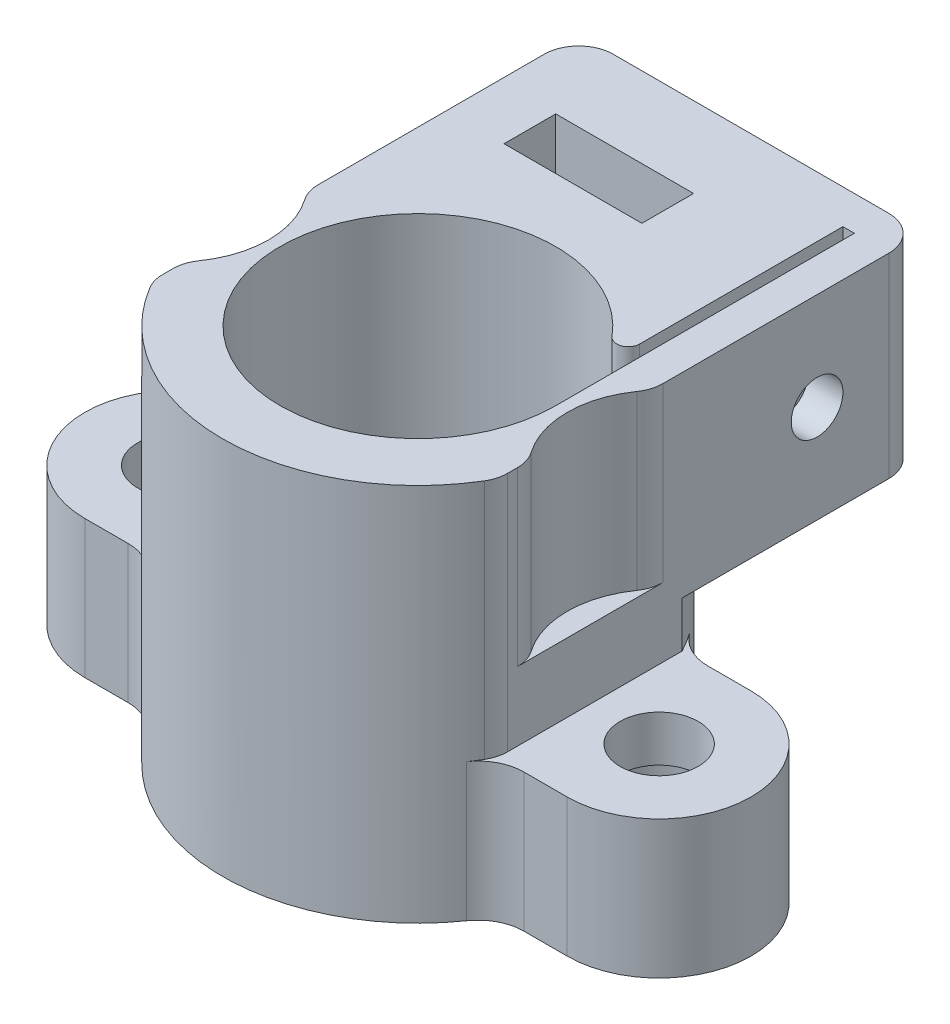
from build123d import *
from build123d.topology import SkipClean

# Parameters (mm, degrees)
BOSS_EXTRU_1_START      = -6
BOSS_EXTRU_1_DEPTH      = 6
BOSS_EXTRU_2_START      = -6
BOSS_EXTRU_2_DEPTH      = 2
ENL_V_START             = -4
ENL_V_MAT_EXTRU_1_DEPTH = 4
ENL_V_START_2           = -16.5
ENL_V_MAT_EXTRU_5_DEPTH = 10.5
CONG_1_R                = 2
CHANFREIN1_SIZE         = 0.5
SYM_TRIE1_START         = -2
SYM_TRIE1_DEPTH         = 10.5
SYM_TRIE1_START_2       = -8
SYM_TRIE1_2_DEPTH       = 4
SYM_TRIE1_START_3       = -7.5000001
SYM_TRIE1_3_DEPTH       = 5.5000001
SYM_TRIE1_START_4       = -4
SYM_TRIE1_4_DEPTH       = 2
SYM_TRIE1_7_DEPTH       = 0.4999999
M3_CLEARANCE_HOLE1_D    = 3.4
BOSS_EXTRU_3_DEPTH      = 8.5
ENL_V_START_3           = -8.5
ENL_V_MAT_EXTRU_2_DEPTH = 8.5
ENL_V_START_4           = -6.5
ESQUISSE5_R             = 1.125
ENL_V_MAT_EXTRU_3_DEPTH = 6
ESQUISSE5_3_R           = 1.125
ENL_V_MAT_EXTRU_4_DEPTH = 6.5
CONG_2_R                = 0.5
CONG_3_R                = 1.5
ENL_V_START_5           = -7.5
ESQUISSE9_R             = 4
ENL_V_MAT_EXTRU_8_DEPTH = 7.5
CONG_5_R                = 1.5
CHANFREIN2_SIZE         = 1


with BuildPart() as part:
    # Esquisse1 → Révolution1 (revolve)
    with BuildSketch(Plane.XY):
        Polygon((-8.5, 8.5), (-6, 8.5), (-6, 0), (-3.5, 0), (-3.5, -1), (-4.383974596, -1), (-5.25, -1.5), (-6.5, -1.5), (-6.5, -8), (-8.5, -8), align=None)
    revolve(axis=Axis((0, 6.43509573, 0), (0, -1, 0)))

    # Esquisse3 → Boss.-Extru.1 (add)
    with BuildSketch(Plane.XZ.offset(8).offset(BOSS_EXTRU_1_START)):
        with BuildLine():
            ThreePointArc((-7.928571429, 3.06394437), (-7.728470361, 3.5384666), (-7.5, 4))
            Line((-7.5, 4), (-10.5, 4))
            ThreePointArc((-10.5, 4), (-14.5, 0), (-10.5, -4))
            Line((-10.5, -4), (-7.5, -4))
            ThreePointArc((-7.5, -4), (-7.728470361, -3.5384666), (-7.928571429, -3.06394437))
            ThreePointArc((-7.928571429, -3.06394437), (-8.196108254, -2.252511816), (-8.380833333, -1.418320358))
            ThreePointArc((-8.380833333, -1.418320358), (-13.05, 0), (-8.380833333, 1.418320358))
            ThreePointArc((-8.380833333, 1.418320358), (-8.196108254, 2.252511816), (-7.928571429, 3.06394437))
        make_face()
    extrude(amount=BOSS_EXTRU_1_DEPTH)

    # Esquisse3<4> → Boss.-Extru.2 (add)
    with BuildSketch(Plane.XZ.offset(8).offset(BOSS_EXTRU_2_START)):
        with BuildLine():
            ThreePointArc((-8.380833333, -1.418320358), (-8.5, 0), (-8.380833333, 1.418320358))
            ThreePointArc((-8.380833333, 1.418320358), (-13.05, 0), (-8.380833333, -1.418320358))
        make_face()
    extrude(amount=BOSS_EXTRU_2_DEPTH)

    # Esquisse3<5> → Enlèv. mat.-Extru.1 (cut)
    with SkipClean():  # the faces are left unmerged after this step: merging them gives an invalid solid
        with BuildSketch(Plane.XZ.offset(8).offset(ENL_V_START)):
            with BuildLine():
                ThreePointArc((-7.95, 0), (-8.06008453, 0.741156191), (-8.380833333, 1.418320358))
                ThreePointArc((-8.380833333, 1.418320358), (-8.5, 0), (-8.380833333, -1.418320358))
                ThreePointArc((-8.380833333, -1.418320358), (-8.06008453, -0.741156191), (-7.95, 0))
            make_face()
        extrude(amount=ENL_V_MAT_EXTRU_1_DEPTH, mode=Mode.SUBTRACT)

    # Esquisse3<7> → Enlèv. mat.-Extru.5 (cut)
    with SkipClean():  # the faces are left unmerged after this step: merging them gives an invalid solid
        with BuildSketch(Plane.XZ.offset(8).offset(ENL_V_START_2)):
            with BuildLine():
                ThreePointArc((-7.5, 4), (-8.5, 0), (-7.5, -4))
                Line((-7.5, -4), (-7.5, 4))
            make_face()
        extrude(amount=ENL_V_MAT_EXTRU_5_DEPTH, mode=Mode.SUBTRACT)

    # Congé1
    # the kernel refuses this fillet: 2 mm, written as the material it adds along each edge
    with BuildSketch(Plane(origin=(-7.5, -2, 4), x_dir=(0.5219209843200922, 0, 0.8529938370975175), z_dir=(0, -1, 0))) as cong_1_piece_1:
        with BuildLine():
            CenterArc((1.12308337, 1.996502992), CONG_1_R, 211.461195757, 55.150095421)
            Line((-0.582904304, 0.952661023), (0, 0))
            ThreePointArc((0, 0), (0.502432034, 0.014862284), (1.004864068, 0))
        make_face()
    extrude(amount=6)
    with BuildSketch(Plane(origin=(-7.5, -2, -4), x_dir=(0.521920984320094, 0, -0.8529938370975163), z_dir=(0, -1, 0))) as cong_1_piece_2:
        with BuildLine():
            CenterArc((1.12308337, -1.996502992), CONG_1_R, 93.388708822, 55.150095421)
            Line((-0.582904304, -0.952661023), (0, 0))
            ThreePointArc((0, 0), (0.502432034, -0.014862284), (1.004864068, 0))
        make_face()
    extrude(amount=6)

    # Chanfrein1
    chanfrein1_edges = [part.edges().sort_by_distance(p)[0] for p in [
        (-7.95, -8, 0),
    ]]
    chamfer(chanfrein1_edges, length=CHANFREIN1_SIZE)

    # Symétrie1: read off the stored shape, not the designer's step
    # Symétrie1 outline → Symétrie1 (cut)
    with BuildSketch(Plane(origin=(0, 0, 0), x_dir=(1, 0, 0), z_dir=(0, 1, 0)).offset(SYM_TRIE1_START)):
        with BuildLine():
            Line((7.5, 4), (7.5, -4))
            ThreePointArc((7.5, -4), (8.5, 0), (7.5, 4))
        make_face()
    extrude(amount=SYM_TRIE1_DEPTH, mode=Mode.SUBTRACT)

    # Sym_trie1 2 outline → Sym_trie1 2 (cut)
    with BuildSketch(Plane(origin=(0, 0, 0), x_dir=(1, 0, 0), z_dir=(0, 1, 0)).offset(SYM_TRIE1_START_2)):
        with BuildLine():
            ThreePointArc((8.380833333, 1.418320358), (7.95, 0), (8.380833333, -1.418320358))
            ThreePointArc((8.380833333, -1.418320358), (8.5, 0), (8.380833333, 1.418320358))
        make_face()
    extrude(amount=SYM_TRIE1_2_DEPTH, mode=Mode.SUBTRACT)

    # Sym_trie1 3 outline → Sym_trie1 3 (add)
    with BuildSketch(Plane(origin=(0, 0, 0), x_dir=(1, 0, 0), z_dir=(0, 1, 0)).offset(SYM_TRIE1_START_3)):
        with BuildLine():
            ThreePointArc((6.975540357, -4.857142857), (7.69102387, -4.227189479), (8.61684397, -4))
            Line((8.61684397, -4), (10.5, -4))
            ThreePointArc((10.5, -4), (14.5, 0), (10.5, 4))
            Line((10.5, 4), (8.61684397, 4))
            ThreePointArc((8.61684397, 4), (7.69102387, 4.227189479), (6.975540357, 4.857142857))
            ThreePointArc((6.975540357, 4.857142857), (7.868349781, 3.215442696), (8.380833333, 1.418320358))
            ThreePointArc((8.380833333, 1.418320358), (13.05, 0), (8.380833333, -1.418320358))
            ThreePointArc((8.380833333, -1.418320358), (7.868349781, -3.215442696), (6.975540357, -4.857142857))
        make_face()
    extrude(amount=SYM_TRIE1_3_DEPTH)

    # Sym_trie1 4 outline → Sym_trie1 4 (add)
    with BuildSketch(Plane(origin=(0, 0, 0), x_dir=(1, 0, 0), z_dir=(0, 1, 0)).offset(SYM_TRIE1_START_4)):
        with BuildLine():
            ThreePointArc((8.380833333, 1.418320358), (8.5, 0), (8.380833333, -1.418320358))
            ThreePointArc((8.380833333, -1.418320358), (13.05, 0), (8.380833333, 1.418320358))
        make_face()
    extrude(amount=SYM_TRIE1_4_DEPTH)

    # Sym_trie1 5 outline → Sym_trie1 5 (revolve, cut)
    with BuildSketch(Plane(origin=(10.5, 0, 0), x_dir=(1, 0, 0), z_dir=(0, 0, 1))):
        Polygon((3.05, -8), (2.55, -7.5), (2.55, -8), align=None)
    revolve(axis=Axis((10.5, 0, 0), (0, 1, 0)), mode=Mode.SUBTRACT)

    # Sym_trie1 6 outline → Sym_trie1 6 (revolve)
    with SkipClean():  # the faces are left unmerged after this step: merging them gives an invalid solid
        with BuildSketch(Plane(origin=(10.5, 0, 0), x_dir=(1, 0, 0), z_dir=(0, 0, 1))):
            Polygon((3.05, -7.5), (2.55, -7.5), (3.05, -8), align=None)
        revolve(axis=Axis((10.5, 0, 0), (0, 1, 0)))

    # Sym_trie1 7 outline → Sym_trie1 7 (add)
    with BuildSketch(Plane(origin=(0, 0, 0), x_dir=(1, 0, 0), z_dir=(0, 1, 0)).offset(SYM_TRIE1_START_2)):
        with BuildLine():
            ThreePointArc((8.2475, 2.056390953), (13.55, 0), (8.2475, -2.056390953))
            ThreePointArc((8.2475, -2.056390953), (7.933495012, -3.051173035), (7.5, -4))
            ThreePointArc((7.5, -4), (7.250447615, -4.436328367), (6.975540357, -4.857142857))
            ThreePointArc((6.975540357, -4.857142857), (7.69102387, -4.227189479), (8.61684397, -4))
            Line((8.61684397, -4), (10.5, -4))
            ThreePointArc((10.5, -4), (14.5, 0), (10.5, 4))
            Line((10.5, 4), (8.61684397, 4))
            ThreePointArc((8.61684397, 4), (7.69102387, 4.227189479), (6.975540357, 4.857142857))
            ThreePointArc((6.975540357, 4.857142857), (7.250447615, 4.436328367), (7.5, 4))
            ThreePointArc((7.5, 4), (7.933495012, 3.051173035), (8.2475, 2.056390953))
        make_face()
    extrude(amount=SYM_TRIE1_7_DEPTH)

    # M3 Clearance Hole1 (through all)
    with Locations(Plane(origin=(0, -4, 0), x_dir=(-1, 0, 0), z_dir=(0, -1, 0))):
        with Locations((10.5, 0), (-10.5, 0)):
            Hole(M3_CLEARANCE_HOLE1_D / 2)

    # Esquisse4 → Boss.-Extru.3 (add)
    with BuildSketch(Plane(origin=(0, 8.5, 0), x_dir=(1, 0, 0), z_dir=(0, 1, 0))):
        with BuildLine():
            Line((7.5, 14.5), (-7.5, 14.5))
            Line((-7.5, 14.5), (-7.5, 4))
            ThreePointArc((-7.5, 4), (-1.593272922, 8.349340177), (5.5, 6.480740698))
            Line((5.5, 6.480740698), (5.5, 13))
            Line((5.5, 13), (6, 13))
            Line((6, 13), (6, 6.020797289))
            ThreePointArc((6, 6.020797289), (6.825203691, 5.066220937), (7.5, 4))
            Line((7.5, 4), (7.5, 14.5))
        make_face()
    extrude(amount=-BOSS_EXTRU_3_DEPTH)

    # Esquisse4<3> → Enlèv. mat.-Extru.2 (cut)
    with BuildSketch(Plane(origin=(0, 8.5, 0), x_dir=(1, 0, 0), z_dir=(0, 1, 0)).offset(ENL_V_START_3)):
        with BuildLine():
            Line((6, 0), (6, 13))
            Line((6, 13), (5.5, 13))
            Line((5.5, 13), (5.5, 2.397915762))
            ThreePointArc((5.5, 2.397915762), (5.873670062, 1.224744871), (6, 0))
        make_face()
    extrude(amount=ENL_V_MAT_EXTRU_2_DEPTH, mode=Mode.SUBTRACT)

    # Esquisse5 → Enlèv. mat.-Extru.3 (cut)
    with BuildSketch(Plane(origin=(7.5, 0, 0), x_dir=(0, 0, -1), z_dir=(1, 0, 0)).offset(ENL_V_START_4)):
        with Locations((9.875, 4.2554)):
            Circle(ESQUISSE5_R)
        with BuildLine():
            Line((8.75, 8.5), (8.75, 4.2554))
            ThreePointArc((8.75, 4.2554), (9.875, 5.3804), (11, 4.2554))
            Line((11, 4.2554), (11, 8.5))
            Line((11, 8.5), (8.75, 8.5))
        make_face()
    extrude(amount=-ENL_V_MAT_EXTRU_3_DEPTH, mode=Mode.SUBTRACT)

    # Esquisse5<3> → Enlèv. mat.-Extru.4 (cut)
    with BuildSketch(Plane(origin=(7.5, 0, 0), x_dir=(0, 0, -1), z_dir=(1, 0, 0))):
        with Locations(Location((9.875, 4.2554, 0), (0, 0, 180))):
            Circle(ESQUISSE5_3_R)
    extrude(amount=-ENL_V_MAT_EXTRU_4_DEPTH, mode=Mode.SUBTRACT)

    # Congé2
    # the kernel refuses this fillet: 0.5 mm, written as the material it takes off along each edge
    with BuildSketch(Plane(origin=(5.5, 0, -2.397915762), x_dir=(0, 0, -1), z_dir=(0, 1, 0))) as cong_2_piece_1:
        with BuildLine():
            CenterArc((1.75539617, 0.5), CONG_2_R, 129.715137232, 140.284862768)
            ThreePointArc((1.435910637, 0.884615385), (0.749192225, 0.391603841), (0, 0))
            Line((0, 0), (1.75539617, 0))
        make_face()
    extrude(amount=12.888490425, mode=Mode.SUBTRACT)

    # Congé3
    cong_3_edges = [part.edges().sort_by_distance(p)[0] for p in [
        (7.5, 3.25, 4),
        (7.5, 4.25, -14.5),
        (-7.5, 4.25, -14.5),
        (-7.5, 3.25, 4),
    ]]
    fillet(cong_3_edges, radius=CONG_3_R)

    # Esquisse9 → Enlèv. mat.-Extru.8 (cut)
    with BuildSketch(Plane(origin=(0, 8.5, 0), x_dir=(1, 0, 0), z_dir=(0, 1, 0)).offset(ENL_V_START_5)):
        with Locations((-10.5, 0)):
            Circle(ESQUISSE9_R)
        with Locations((10.5, 0)):
            Circle(ESQUISSE9_R)
    extrude(amount=ENL_V_MAT_EXTRU_8_DEPTH, mode=Mode.SUBTRACT)

    # Congé5
    cong_5_edges = [part.edges().sort_by_distance(p)[0] for p in [
        (7.5, 4.75, -2.645751311),
        (7.5, 4.75, 2.645751311),
        (-7.5, 4.75, -2.645751311),
        (-7.5, 4.75, 2.645751311),
    ]]
    fillet(cong_5_edges, radius=CONG_5_R)

    # Chanfrein2
    # the kernel refuses this chamfer: 1 mm, written as the material it takes off along each edge
    with BuildSketch(Plane(origin=(0, -8, 0), x_dir=(-1, 0, 0), z_dir=(0, 0, 1))) as chanfrein2_piece_1:
        Polygon((6.5 + CHANFREIN2_SIZE, 0), (6.5, -CHANFREIN2_SIZE), (6.5, 0), align=None)
    revolve(axis=Axis((0, -8, 0), (0, -1, 0)), mode=Mode.SUBTRACT)


solid = part.part
